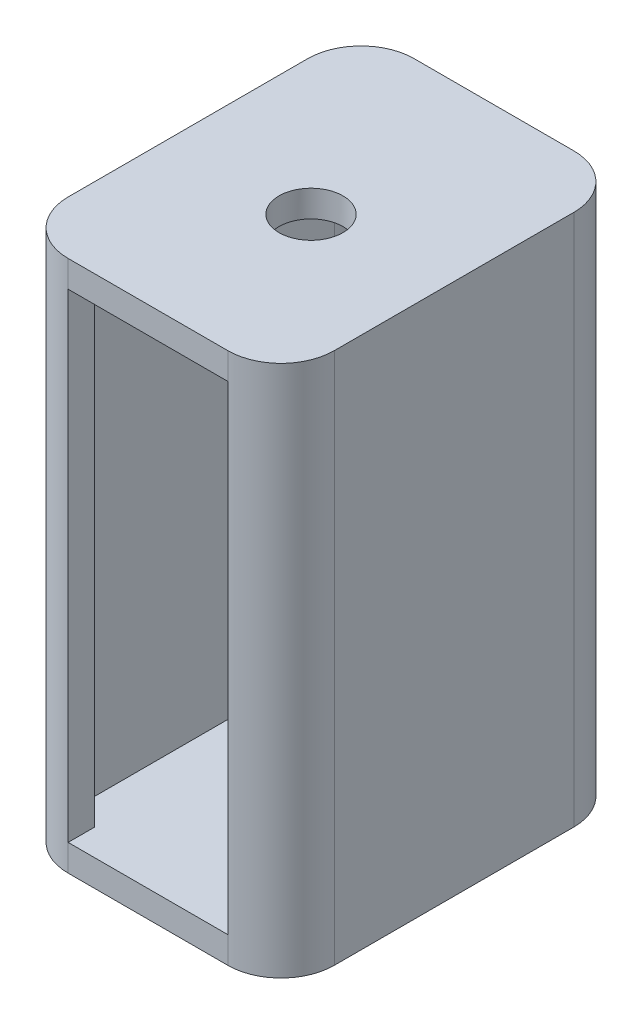
from build123d import *

# Parameters (mm, degrees)
CROQUIS1_W              = 65
CROQUIS1_H              = 100
SALIENTE_EXTRUIR1_DEPTH = 50
REDONDEO1_R             = 10
VACIADO1_START          = 5
VACIADO1_DEPTH          = 90
CROQUIS3_R              = 6
CORTAR_EXTRUIR1_DEPTH   = 130.325171564


# Read off the part's stored shape, not the designer's step: Vaciado1
with BuildPart() as part:
    # Croquis1 → Saliente-Extruir1 (new body)
    with BuildSketch(Plane(origin=(0, 0, 0), x_dir=(0, 0, -1), z_dir=(1, 0, 0))):
        with Locations((32.5, 50)):
            Rectangle(CROQUIS1_W, CROQUIS1_H)
    extrude(amount=SALIENTE_EXTRUIR1_DEPTH)

    # Redondeo1
    redondeo1_edges = [part.edges().sort_by_distance(p)[0] for p in [
        (50, 50, -65),
        (50, 50, 0),
        (0, 50, -65),
        (0, 50, 0),
    ]]
    fillet(redondeo1_edges, radius=REDONDEO1_R)

    # Vaciado1 outline → Vaciado1 (cut)
    with BuildSketch(Plane(origin=(0, 0, 0), x_dir=(1, 0, 0), z_dir=(0, 1, 0)).offset(VACIADO1_START)):
        with BuildLine():
            Line((10, 0), (40, 0))
            Line((40, 0), (40, 5))
            ThreePointArc((40, 5), (43.535533906, 6.464466094), (45, 10))
            Line((45, 10), (45, 55))
            ThreePointArc((45, 55), (43.535533906, 58.535533906), (40, 60))
            Line((40, 60), (10, 60))
            ThreePointArc((10, 60), (6.464466094, 58.535533906), (5, 55))
            Line((5, 55), (5, 10))
            ThreePointArc((5, 10), (6.464466094, 6.464466094), (10, 5))
            Line((10, 5), (10, 0))
        make_face()
    extrude(amount=VACIADO1_DEPTH, mode=Mode.SUBTRACT)

    # Croquis3 → Cortar-Extruir1 (cut, through all)
    with BuildSketch(Plane(origin=(0, 100, 0), x_dir=(1, 0, 0), z_dir=(0, 1, 0))):
        with Locations(Location((25.623850115, 30, 0), (0, 0, 270))):
            Circle(CROQUIS3_R)
    extrude(amount=-CORTAR_EXTRUIR1_DEPTH, mode=Mode.SUBTRACT)


solid = part.part
